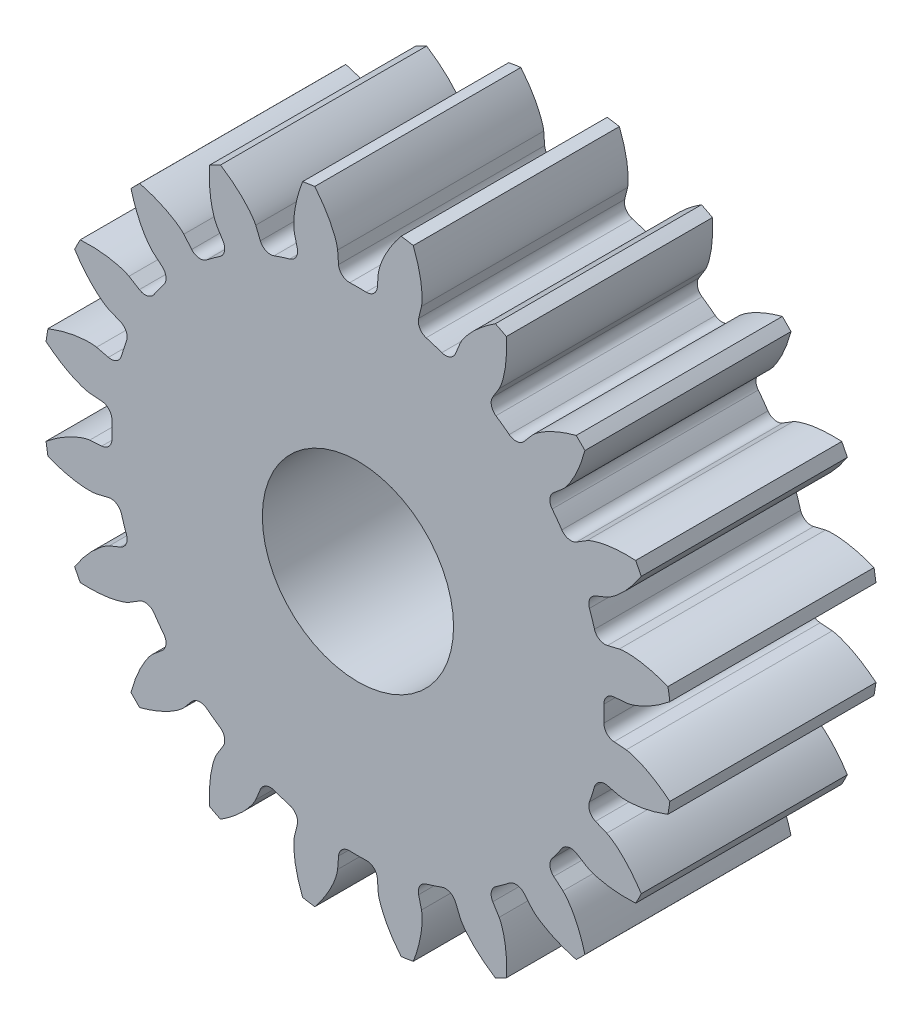
from build123d import *

# Parameters (mm, degrees)
BLANK_SKETCH_R    = 13.75
BLANK_DEPTH       = 9
TOOTH_SPACE_DEPTH = 22.427202337
TEETH_COUNT       = 20
BORE_DEPTH        = 22.260792111
BORE_DEPTH_BACK   = 22.260792111
BORE_SKETCH_R     = 4.175


with BuildPart() as part:
    # Blank Sketch → Blank (new body)
    with BuildSketch(Plane.XY):
        Circle(BLANK_SKETCH_R)
    extrude(amount=BLANK_DEPTH)

    # Tooth Space Sketch → Tooth Space (cut, symmetric)
    with BuildSketch(Plane.XY):
        with BuildLine():
            Line((11.712575542, 0.887578892), (11.182881902, 0.847438712))
            ThreePointArc((11.182881902, 0.847438712), (10.865110495, 0.690887858), (10.744037928, 0.357979056))
            ThreePointArc((10.744037928, 0.357979056), (10.75, 0), (10.744037928, -0.357979056))
            ThreePointArc((10.744037928, -0.357979056), (10.865110495, -0.690887858), (11.182881902, -0.847438712))
            Line((11.182881902, -0.847438712), (11.712575542, -0.887578892))
            add(Edge.make_bspline(
                [(11.712575542, -0.887578892), (11.718030456, -0.888084575), (11.733302224, -0.889786577), (11.762055049, -0.894123642), (11.808748116, -0.902783585), (11.867871522, -0.916136728), (11.943785045, -0.936044148), (12.032491205, -0.962883715), (12.129128281, -0.995906017), (12.233254944, -1.03560915), (12.336170252, -1.078535303), (12.437866469, -1.124417613), (12.538256203, -1.172869671), (12.658707015, -1.234774129), (12.801489519, -1.313454101), (12.965790887, -1.41181046), (13.148934646, -1.53083847), (13.331913845, -1.659992212), (13.508861665, -1.793481702), (13.683836959, -1.93555224), (13.850418726, -2.078105804), (14.019262166, -2.233337092), (14.17300458, -2.380287394), (14.340363277, -2.552637942), (14.474017151, -2.69399985), (14.607838338, -2.84630742), (14.672335873, -2.921355394), (14.70502791, -2.960093607)],
                knots=[0, 0, 0, 0, 0, 0.005376749, 0.015083688, 0.02853182, 0.046610139, 0.064854849, 0.092110525, 0.119476176, 0.146842496, 0.174208854, 0.201574956, 0.228941013, 0.256307345, 0.307035032, 0.361767352, 0.41649966, 0.471231936, 0.525964282, 0.580696615, 0.635428982, 0.690161387, 0.744893688, 0.799626082, 0.854358408, 0.909090915, 0.909090915, 0.909090915, 0.909090915, 0.909090915], degree=4))
            Line((14.70502791, -2.960093607), (14.70502791, 2.960093607))
            add(Edge.make_bspline(
                [(11.712575542, 0.887578892), (11.718030456, 0.888084575), (11.733302224, 0.889786577), (11.762055049, 0.894123642), (11.808748116, 0.902783585), (11.867871522, 0.916136728), (11.943785045, 0.936044148), (12.032491205, 0.962883715), (12.129128281, 0.995906017), (12.233254944, 1.03560915), (12.336170252, 1.078535303), (12.437866469, 1.124417613), (12.538256203, 1.172869671), (12.658707015, 1.234774129), (12.801489519, 1.313454101), (12.965790887, 1.41181046), (13.148934646, 1.53083847), (13.331913845, 1.659992212), (13.508861665, 1.793481702), (13.683836959, 1.93555224), (13.850418726, 2.078105804), (14.019262166, 2.233337092), (14.17300458, 2.380287394), (14.340363277, 2.552637942), (14.474017151, 2.69399985), (14.607838338, 2.84630742), (14.672335873, 2.921355394), (14.70502791, 2.960093607)],
                knots=[0, 0, 0, 0, 0, 0.005376749, 0.015083688, 0.02853182, 0.046610139, 0.064854849, 0.092110525, 0.119476176, 0.146842496, 0.174208854, 0.201574956, 0.228941013, 0.256307345, 0.307035032, 0.361767352, 0.41649966, 0.471231936, 0.525964282, 0.580696615, 0.635428982, 0.690161387, 0.744893688, 0.799626082, 0.854358408, 0.909090915, 0.909090915, 0.909090915, 0.909090915, 0.909090915], degree=4))
        make_face()
    tooth_space = extrude(amount=TOOTH_SPACE_DEPTH, both=True, mode=Mode.SUBTRACT)

    # Teeth: Tooth Space ×20 about axis
    teeth_axis = Axis((0, 0, -0.45007105), (0, 0, 1))
    for i in range(1, TEETH_COUNT):
        add(tooth_space.rotate(teeth_axis, i * 360 / TEETH_COUNT), mode=Mode.SUBTRACT)

    # Bore Sketch → Bore (cut, two sides: drawn at the far end of the back side and taken through both)
    with BuildSketch(Plane.XY.offset(-BORE_DEPTH_BACK)):
        Circle(BORE_SKETCH_R)
    extrude(amount=BORE_DEPTH + BORE_DEPTH_BACK, mode=Mode.SUBTRACT)


solid = part.part
